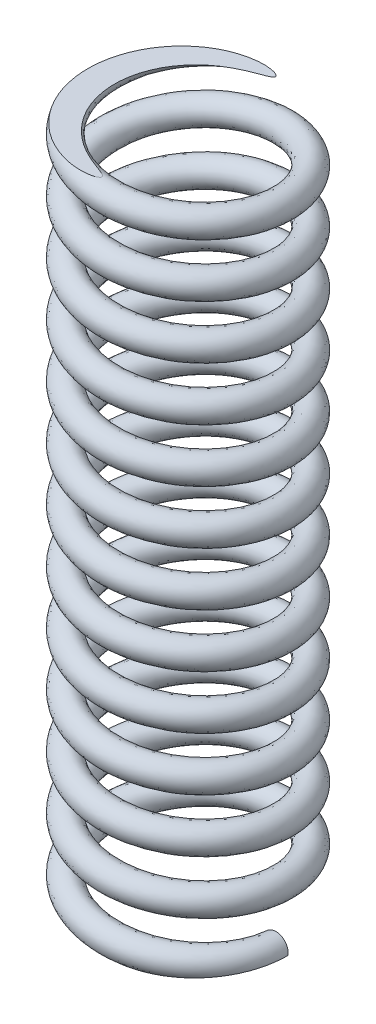
from build123d import *

# Parameters (mm, degrees)
SWEEP1_PITCH        = 2
SWEEP1_HEIGHT       = 26
SWEEP1_RADIUS       = 3.25
SWEEP1_START_ANGLE  = 90
SKETCH2_R           = 0.5
EXTRUDE1_DEPTH      = 10
EXTRUDE1_DEPTH_BACK = 10
SKETCH3_W           = 8
SKETCH3_H           = 3


with BuildPart() as part:
    # Sweep1: sweep along a helix
    with BuildLine() as sweep1_path:
        add(Helix(SWEEP1_PITCH, SWEEP1_HEIGHT, SWEEP1_RADIUS, center=(0, 0, 0), direction=(0, 1, 0), lefthand=True, mode=Mode.PRIVATE).rotate(Axis((0, 0, 0), (0, 1, 0)), SWEEP1_START_ANGLE))
    # Sketch2 → Sweep1 (sweep)
    with BuildSketch(Plane(origin=(3.25, 0, 0), x_dir=(1, 0, 0), z_dir=(4.08415902563952e-15, 0.09747510244715203, 0.995237963706629))):
        Circle(SKETCH2_R)
    sweep(path=sweep1_path.line, is_frenet=True)

    # Sketch3 → Extrude1 (cut, two sides: drawn at the far end of the back side and taken through both)
    with BuildSketch(Plane.XY.offset(-EXTRUDE1_DEPTH_BACK)):
        with Locations((0, -1.5)):
            Rectangle(SKETCH3_W, SKETCH3_H)
        with Locations((0, 26.5)):
            Rectangle(SKETCH3_W, SKETCH3_H)
    extrude(amount=EXTRUDE1_DEPTH + EXTRUDE1_DEPTH_BACK, mode=Mode.SUBTRACT)


solid = part.part
